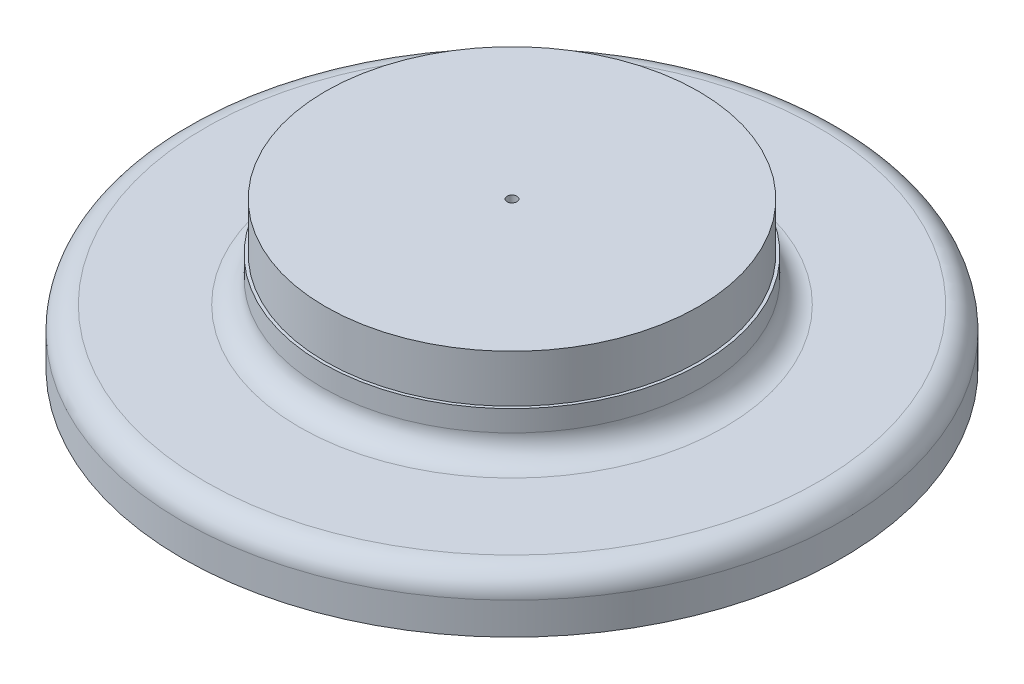
from build123d import *

# Parameters (mm, degrees)
SKETCH1_R                                           = 228.6
SKETCH1_R_2                                         = 131.445
BOSS_EXTRUDE1_DEPTH                                 = 38.1
SKETCH1_3_R                                         = 131.445
SKETCH1_3_R_2                                       = 129.413
BOSS_EXTRUDE2_DEPTH                                 = 68.58
SKETCH1_4_R                                         = 129.413
BOSS_EXTRUDE3_DEPTH                                 = 101.6
CSK_FOR_1_4_FLAT_HEAD_MACHINE_SCREW_100_D           = 6.7564
CSK_FOR_1_4_FLAT_HEAD_MACHINE_SCREW_100_CSINK_D     = 12.8778
CSK_FOR_1_4_FLAT_HEAD_MACHINE_SCREW_100_CSINK_ANGLE = 100
FILLET1_R                                           = 15.875
FILLET2_R                                           = 15.875


with BuildPart() as part:
    # Sketch1 → Boss-Extrude1 (new body)
    with BuildSketch(Plane(origin=(0, 0, 0), x_dir=(1, 0, 0), z_dir=(0, 1, 0))):
        Circle(SKETCH1_R)
        Circle(SKETCH1_R_2, mode=Mode.SUBTRACT)
    extrude(amount=BOSS_EXTRUDE1_DEPTH)

    # Sketch1<3> → Boss-Extrude2 (add)
    with BuildSketch(Plane(origin=(0, 0, 0), x_dir=(1, 0, 0), z_dir=(0, 1, 0))):
        Circle(SKETCH1_3_R)
        Circle(SKETCH1_3_R_2, mode=Mode.SUBTRACT)
    extrude(amount=BOSS_EXTRUDE2_DEPTH)

    # Sketch1<4> → Boss-Extrude3 (add)
    with BuildSketch(Plane(origin=(0, 0, 0), x_dir=(1, 0, 0), z_dir=(0, 1, 0))):
        Circle(SKETCH1_4_R)
    extrude(amount=BOSS_EXTRUDE3_DEPTH)

    # CSK for 1/4 Flat Head Machine Screw (100)1 (through all)
    with Locations(Plane(origin=(0, 0, 0), x_dir=(-1, 0, 0), z_dir=(0, -1, 0))):
        with Locations((0, 0)):
            CounterSinkHole(CSK_FOR_1_4_FLAT_HEAD_MACHINE_SCREW_100_D / 2, CSK_FOR_1_4_FLAT_HEAD_MACHINE_SCREW_100_CSINK_D / 2, counter_sink_angle=CSK_FOR_1_4_FLAT_HEAD_MACHINE_SCREW_100_CSINK_ANGLE)

    # Fillet1
    fillet1_edges = [part.edges().sort_by_distance(p)[0] for p in [
        (-131.445, 38.1, 0),
    ]]
    fillet(fillet1_edges, radius=FILLET1_R)

    # Fillet2
    fillet2_edges = [part.edges().sort_by_distance(p)[0] for p in [
        (-228.6, 38.1, 0),
    ]]
    fillet(fillet2_edges, radius=FILLET2_R)


solid = part.part
